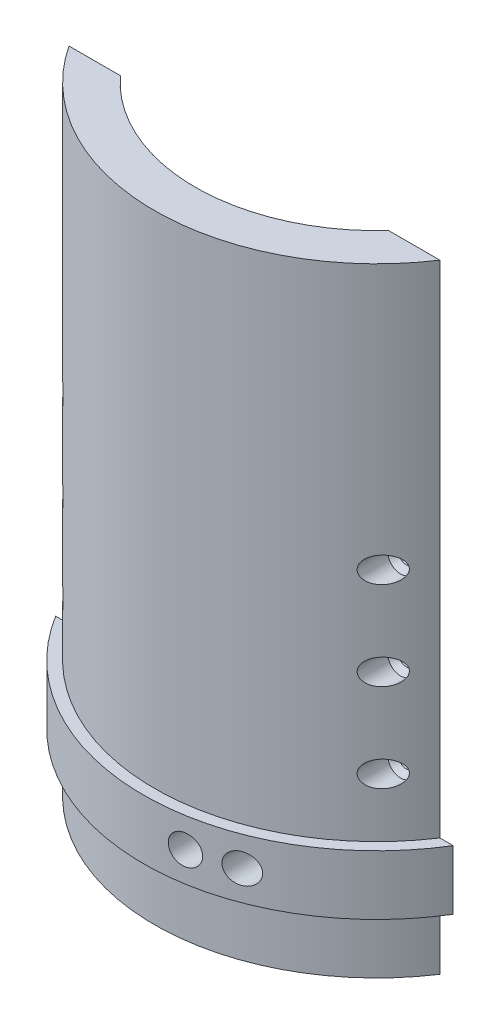
from build123d import *

# Parameters (mm, degrees)
BOSS_EXTRUDE1_DEPTH      = 100
LPATTERN1_COUNT          = 4
LPATTERN1_PITCH          = 20
BOSS_EXTRUDE2_DEPTH      = 6.731
BOSS_EXTRUDE2_DEPTH_BACK = 6.731
SKETCH9_R                = 3.334469726
CUT_EXTRUDE1_DEPTH       = 34
BOSS_EXTRUDE3_DEPTH      = 40


with BuildPart() as part:
    # Sketch1 → Boss-Extrude1 (new body)
    with BuildSketch(Plane(origin=(60.535204745, 0, -85.948449604), x_dir=(1, 0, 0), z_dir=(0, 1, 0))):
        with BuildLine():
            ThreePointArc((-30.186446753, -113.644462538), (-60.535204745, -127.035141416), (-90.883962736, -113.644462538))
            Line((-90.883962736, -113.644462538), (-102.513962844, -113.644462538))
            ThreePointArc((-102.513962844, -113.644462538), (-60.535204745, -136.240449604), (-18.556446645, -113.644462538))
            Line((-18.556446645, -113.644462538), (-30.186446753, -113.644462538))
        make_face()
    extrude(amount=BOSS_EXTRUDE1_DEPTH)

    # Sketch6 → Cut-Revolve4 (revolve, cut)
    with BuildSketch(Plane(origin=(36.163758045, 20, 27.696012934), x_dir=(-1, 0, 0), z_dir=(0, -1, 0))):
        Polygon((0, 1.685394277), (0, -4.78184701), (0, -15.185924704), (-2.9, -15.185924704), (-2.9, -3.079025683), (-1.65, -1.881964943), (-1.65, 1.685394277), align=None)
    cut_revolve4 = revolve(axis=Axis((36.163758045, 20, 26.010618657), (0, 0, 1)), mode=Mode.SUBTRACT)

    # LPattern1: Cut-Revolve4 ×4
    with Locations(*[(0, i * LPATTERN1_PITCH, 0) for i in range(1, LPATTERN1_COUNT)]):
        add(cut_revolve4, mode=Mode.SUBTRACT)

    # Mirror1: Cut-Revolve4 across plane
    add(cut_revolve4.mirror(Plane(origin=(0, 0, 0), x_dir=(0, 0, 1), z_dir=(1, 0, 0))), mode=Mode.SUBTRACT)

    # Mirror1 copy 1 sketch → Mirror1 copy 1 (revolve, cut)
    with BuildSketch(Plane(origin=(-36.163758045, 40, 27.696012934), x_dir=(1, 0, 0), z_dir=(0, -1, 0))):
        Polygon((0, -1.685394277), (0, 4.78184701), (0, 15.185924704), (-2.9, 15.185924704), (-2.9, 3.079025683), (-1.65, 1.881964943), (-1.65, -1.685394277), align=None)
    revolve(axis=Axis((-36.163758045, 40, 26.010618657), (0, 0, -1)), mode=Mode.SUBTRACT)

    # Mirror1 copy 2 sketch → Mirror1 copy 2 (revolve, cut)
    with BuildSketch(Plane(origin=(-36.163758045, 60, 27.696012934), x_dir=(1, 0, 0), z_dir=(0, -1, 0))):
        Polygon((0, -1.685394277), (0, 4.78184701), (0, 15.185924704), (-2.9, 15.185924704), (-2.9, 3.079025683), (-1.65, 1.881964943), (-1.65, -1.685394277), align=None)
    revolve(axis=Axis((-36.163758045, 60, 26.010618657), (0, 0, -1)), mode=Mode.SUBTRACT)

    # Mirror1 copy 3 sketch → Mirror1 copy 3 (revolve, cut)
    with BuildSketch(Plane(origin=(-36.163758045, 80, 27.696012934), x_dir=(1, 0, 0), z_dir=(0, -1, 0))):
        Polygon((0, -1.685394277), (0, 4.78184701), (0, 15.185924704), (-2.9, 15.185924704), (-2.9, 3.079025683), (-1.65, 1.881964943), (-1.65, -1.685394277), align=None)
    revolve(axis=Axis((-36.163758045, 80, 26.010618657), (0, 0, -1)), mode=Mode.SUBTRACT)

    # Sketch7 → Boss-Extrude2 (add, two sides: drawn at the far end of the back side and taken through both)
    with BuildSketch(Plane(origin=(0, 20, 0), x_dir=(-1, 0, 0), z_dir=(0, -1, 0)).offset(-BOSS_EXTRUDE2_DEPTH_BACK)):
        with BuildLine():
            Line((-44.990566695, -27.696012934), (-41.978758099, -27.696012934))
            ThreePointArc((-41.978758099, -27.696012934), (0, -50.292), (41.978758099, -27.696012934))
            Line((41.978758099, -27.696012934), (44.990566695, -27.696012934))
            ThreePointArc((44.990566695, -27.696012934), (0, -52.832), (-44.990566695, -27.696012934))
        make_face()
    extrude(amount=BOSS_EXTRUDE2_DEPTH + BOSS_EXTRUDE2_DEPTH_BACK)

    # Sketch9 → Cut-Extrude1 (cut)
    with BuildSketch(Plane(origin=(0, 0, 27.696012934), x_dir=(-1, 0, 0), z_dir=(0, 0, -1))):
        with Locations((-18.801989508, 20)):
            Circle(SKETCH9_R)
        with Locations((-8.69556827, 20)):
            Circle(SKETCH9_R)
    extrude(amount=-CUT_EXTRUDE1_DEPTH, mode=Mode.SUBTRACT)

    # Sketch10 → Boss-Extrude3 (add)
    with BuildSketch(Plane(origin=(0, 100, 0), x_dir=(1, 0, 0), z_dir=(0, 1, 0))):
        with BuildLine():
            Line((-30.348757991, -27.696012934), (-41.978758099, -27.696012934))
            ThreePointArc((-41.978758099, -27.696012934), (0, -50.292), (41.978758099, -27.696012934))
            Line((41.978758099, -27.696012934), (30.348757991, -27.696012934))
            ThreePointArc((30.348757991, -27.696012934), (0, -41.086691812), (-30.348757991, -27.696012934))
        make_face()
    extrude(amount=BOSS_EXTRUDE3_DEPTH)


solid = part.part
